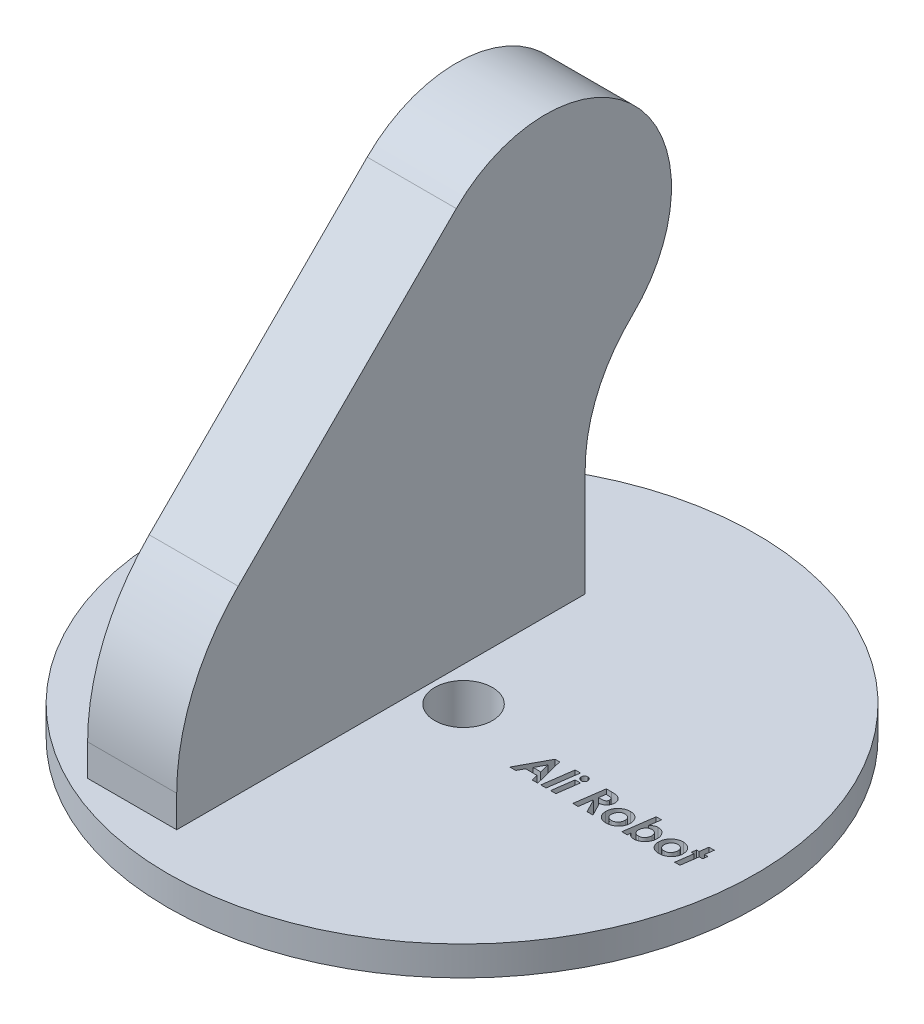
from build123d import *

# Parameters (mm, degrees)
SKETCH2_R           = 35
BOSS_EXTRUDE1_DEPTH = 3.5
BOSS_EXTRUDE2_DEPTH = 10.6
SKETCH33_R          = 30
BOSS_EXTRUDE3_DEPTH = 2.2
SKETCH35_R          = 3.43
CUT_EXTRUDE22_DEPTH = 120.985333145
CUT_EXTRUDE24_DEPTH = 3


with BuildPart() as part:
    # Sketch2 → Boss-Extrude1 (new body)
    with BuildSketch(Plane(origin=(0, 0, 0), x_dir=(1, 0, 0), z_dir=(0, 1, 0))):
        Circle(SKETCH2_R)
    extrude(amount=BOSS_EXTRUDE1_DEPTH)

    # Sketch33 → Boss-Extrude3 (add)
    with BuildSketch(Plane.XZ):
        Circle(SKETCH33_R)
    extrude(amount=BOSS_EXTRUDE3_DEPTH)

    # Sketch35 → Cut-Extrude22 (cut, through all)
    with BuildSketch(Plane(origin=(64.920383929, 3.5, -6.612415768), x_dir=(1, 0, 0), z_dir=(0, 1, 0))):
        with Locations((-64.816151671, -6.541004949)):
            Circle(SKETCH35_R)
    extrude(amount=-CUT_EXTRUDE22_DEPTH, mode=Mode.SUBTRACT)

    # Sketch38 → Cut-Extrude24 (cut)
    # profile 1 of 9: a face of its own
    with BuildSketch(Plane(origin=(0, 3.5, 0), x_dir=(1, 0, 0), z_dir=(0, 1, 0))):
        Polygon((11.234213374, -0.170104505), (11.785295104, -0.170104505), (12.673616419, -3.670104505), (12.027182124, -3.670104505), (11.833672508, -2.907283992), (10.469289496, -2.907283992), (10.059834367, -3.670104505), (9.353103598, -3.670104505), align=None)
        Polygon((11.684333566, -2.323950659), (11.395471387, -1.184627742), (10.78339206, -2.323950659), align=None, mode=Mode.SUBTRACT)
    # profile 2 of 9: a face of its own
    with BuildSketch(Plane(origin=(0, 3.5, 0), x_dir=(1, 0, 0), z_dir=(0, 1, 0))):
        Polygon((13.535996226, -0.080360915), (14.169810329, -0.080360915), (13.66640488, -3.670104505), (13.032590778, -3.670104505), align=None)
    # profile 3 of 9: a face of its own
    with BuildSketch(Plane(origin=(0, 3.5, 0), x_dir=(1, 0, 0), z_dir=(0, 1, 0))):
        with BuildLine():
            add(Edge.make_bspline(
                [(15.006949752, -0.03548912), (15.033724236, -0.037050399), (15.086317182, -0.040117209), (15.162584245, -0.062149233), (15.231434376, -0.101556531), (15.293403814, -0.152881213), (15.344728495, -0.21485065), (15.384135793, -0.283700781), (15.406167817, -0.359967844), (15.409234627, -0.41256079), (15.410795906, -0.439335274)],
                knots=[0, 0, 0, 0, 1.014134371, 1.992057583, 2.975098753, 4, 5.024901247, 6.007942417, 6.985865629, 8, 8, 8, 8], degree=3))
            add(Edge.make_bspline(
                [(15.410795906, -0.439335274), (15.409245272, -0.466115808), (15.406199373, -0.518720637), (15.383956784, -0.595099209), (15.344970591, -0.664433822), (15.29334378, -0.726417249), (15.231646153, -0.777958507), (15.162369408, -0.816365475), (15.086344614, -0.83860223), (15.03373349, -0.841636642), (15.006949752, -0.843181428)],
                knots=[0, 0, 0, 0, 1.013694729, 1.991193998, 2.981551723, 4.006008661, 5.030465598, 6.008806002, 6.986305271, 8, 8, 8, 8], degree=3))
            add(Edge.make_bspline(
                [(15.006949752, -0.843181428), (14.980160104, -0.841647208), (14.927537372, -0.83863355), (14.85139842, -0.816186723), (14.781641719, -0.77820039), (14.719927005, -0.726358021), (14.668084636, -0.664643307), (14.630098303, -0.594886606), (14.607651476, -0.518747654), (14.604637818, -0.466124922), (14.603103598, -0.439335274)],
                knots=[0, 0, 0, 0, 1.01324697, 1.990314468, 2.975995575, 4, 5.024004425, 6.009685532, 6.98675303, 8, 8, 8, 8], degree=3))
            add(Edge.make_bspline(
                [(14.603103598, -0.439335274), (14.604648384, -0.412551536), (14.607682796, -0.359940413), (14.629919552, -0.283915618), (14.668326519, -0.214638873), (14.719867777, -0.152941246), (14.781851204, -0.101314435), (14.851185818, -0.062328242), (14.927564389, -0.040085653), (14.980169218, -0.037039754), (15.006949752, -0.03548912)],
                knots=[0, 0, 0, 0, 1.013694729, 1.991193998, 2.969534402, 3.993991339, 5.018448277, 6.008806002, 6.986305271, 8, 8, 8, 8], degree=3))
        make_face()
    # profile 4 of 9: a face of its own
    with BuildSketch(Plane(origin=(0, 3.5, 0), x_dir=(1, 0, 0), z_dir=(0, 1, 0))):
        Polygon((14.562438534, -1.112412197), (15.196252637, -1.112412197), (14.833071547, -3.670104505), (14.199257444, -3.670104505), align=None)
    # profile 5 of 9: a face of its own
    with BuildSketch(Plane(origin=(0, 3.5, 0), x_dir=(1, 0, 0), z_dir=(0, 1, 0))):
        with BuildLine():
            Line((17.337478598, -0.170104505), (17.945351194, -0.170104505))
            add(Edge.make_bspline(
                [(17.945351194, -0.170104505), (17.990461912, -0.170288853), (18.0774408, -0.170644298), (18.20251927, -0.175698725), (18.317320027, -0.183324297), (18.421706567, -0.19338775), (18.515766042, -0.207350229), (18.599302851, -0.224114981), (18.672850562, -0.242784868), (18.716956864, -0.260134145), (18.737618822, -0.268261556)],
                knots=[0, 0, 0, 0, 1.348808202, 2.600664361, 3.742342956, 4.788858012, 5.735658768, 6.584006912, 7.336666444, 8, 8, 8, 8], degree=3))
            add(Edge.make_bspline(
                [(18.737618822, -0.268261556), (18.760881531, -0.278751926), (18.806356444, -0.29925894), (18.871519344, -0.334019586), (18.932539327, -0.371466236), (18.988405098, -0.413010751), (19.040295597, -0.456903826), (19.087889056, -0.503562941), (19.130802248, -0.55370417), (19.169485538, -0.606428163), (19.203882551, -0.661666729), (19.233408844, -0.719692265), (19.258939718, -0.780013512), (19.278877214, -0.843286871), (19.29544767, -0.908752815), (19.30616484, -0.97682439), (19.313707078, -1.04727198), (19.314326819, -1.095096686), (19.31464206, -1.119423415)],
                knots=[0, 0, 0, 0, 1.116361014, 2.182309107, 3.229450697, 4.24598407, 5.225421932, 6.201651319, 7.158895679, 8.110002388, 9.060669178, 10.002827475, 10.956240434, 11.923213192, 12.902917952, 13.908279153, 14.936015885, 16, 16, 16, 16], degree=3))
            add(Edge.make_bspline(
                [(19.31464206, -1.119423415), (19.313900694, -1.14935913), (19.312437117, -1.208457078), (19.302873802, -1.295604951), (19.285037031, -1.379232383), (19.261016279, -1.459602808), (19.231256497, -1.537236615), (19.192877363, -1.610782918), (19.148515858, -1.681523171), (19.097282847, -1.748529924), (19.040017621, -1.812417855), (18.973896349, -1.869427088), (18.902576953, -1.923391655), (18.823129531, -1.97069347), (18.737739084, -2.014632643), (18.644457977, -2.051860582), (18.545036949, -2.086216223), (18.475324737, -2.103410743), (18.43964206, -2.112211877)],
                knots=[0, 0, 0, 0, 0.995453645, 1.965186658, 2.910129054, 3.83459069, 4.752398018, 5.669942118, 6.588407184, 7.525617038, 8.471772905, 9.435289717, 10.423772802, 11.441988612, 12.505459691, 13.613754905, 14.778583949, 16, 16, 16, 16], degree=3))
            Line((18.43964206, -2.112211877), (19.247334367, -3.670104505))
            Line((19.247334367, -3.670104505), (18.545511451, -3.670104505))
            Line((18.545511451, -3.670104505), (17.754646066, -2.144463479))
            Line((17.754646066, -2.144463479), (17.695050713, -2.144463479))
            Line((17.695050713, -2.144463479), (17.480507444, -3.670104505))
            Line((17.480507444, -3.670104505), (16.846693342, -3.670104505))
            Line((16.846693342, -3.670104505), (17.337478598, -0.170104505))
        make_face()
        with BuildLine():
            add(Edge.make_bspline(
                [(17.777081963, -1.561130146), (17.822194038, -1.560711256), (17.908482086, -1.559910025), (18.031718476, -1.554336883), (18.14284927, -1.545533343), (18.241553965, -1.532952509), (18.328092207, -1.518073936), (18.40209638, -1.499499099), (18.463905682, -1.477413957), (18.514495006, -1.451223183), (18.555475842, -1.42047266), (18.590946517, -1.387657032), (18.620482235, -1.350923569), (18.644851849, -1.31088895), (18.66364733, -1.267470195), (18.677201777, -1.220373146), (18.684696139, -1.16991183), (18.685848236, -1.135105351), (18.686436931, -1.11732005)],
                knots=[0, 0, 0, 0, 1.892208387, 3.619318591, 5.173427176, 6.566868293, 7.791773198, 8.8545744, 9.763297566, 10.539470204, 11.233547833, 11.906251103, 12.5615143, 13.203742025, 13.866659999, 14.539934446, 15.25394049, 16, 16, 16, 16], degree=3))
            add(Edge.make_bspline(
                [(18.686436931, -1.11732005), (18.685674889, -1.097154087), (18.68419663, -1.058034883), (18.671410296, -1.001691948), (18.649546106, -0.950581254), (18.618818966, -0.905191441), (18.580473147, -0.865168951), (18.53369335, -0.832205814), (18.479014112, -0.806257483), (18.427792709, -0.789114207), (18.379308966, -0.779184383), (18.334112776, -0.772512871), (18.280601749, -0.7660751), (18.218614928, -0.761314571), (18.148226827, -0.75816557), (18.069473284, -0.755105638), (17.982513177, -0.754017509), (17.921746603, -0.753636911), (17.889962572, -0.753437838)],
                knots=[0, 0, 0, 0, 0.974340854, 1.890087692, 2.776057671, 3.647490651, 4.526730822, 5.442477659, 6.397820337, 7.445016909, 8.045730266, 8.789007992, 9.653967296, 10.651691253, 11.794598421, 13.061237498, 14.462876682, 16, 16, 16, 16], degree=3))
            Line((17.889962572, -0.753437838), (17.777081963, -1.561130146))
        make_face(mode=Mode.SUBTRACT)
    # profile 6 of 9: a face of its own
    with BuildSketch(Plane(origin=(0, 3.5, 0), x_dir=(1, 0, 0), z_dir=(0, 1, 0))):
        with BuildLine():
            add(Edge.make_bspline(
                [(21.10390488, -1.067540402), (21.132205676, -1.067801263), (21.188216739, -1.068317542), (21.271251688, -1.076791941), (21.352561402, -1.088283547), (21.431755309, -1.105087467), (21.508763418, -1.127042832), (21.583911738, -1.1537877), (21.657385991, -1.185052775), (21.728169586, -1.221737771), (21.79620025, -1.2622808), (21.860854534, -1.306994684), (21.921055687, -1.356524279), (21.978491813, -1.408937638), (22.030743266, -1.466611664), (22.079230459, -1.527904512), (22.124539495, -1.592781526), (22.16560308, -1.661642395), (22.201764854, -1.734065485), (22.234420935, -1.808192303), (22.261103392, -1.885165214), (22.28235286, -1.964249823), (22.30065848, -2.045266898), (22.311711934, -2.128584003), (22.320319088, -2.213929685), (22.32080558, -2.271576635), (22.321052316, -2.30081364)],
                knots=[0, 0, 0, 0, 1.048380346, 2.074885017, 3.090367486, 4.090964834, 5.072523792, 6.056029873, 7.045505985, 8.029469653, 9.008388104, 9.979110116, 10.939576094, 11.895736256, 12.858269977, 13.820062943, 14.790784955, 15.789017664, 16.788414625, 17.789274365, 18.789121639, 19.804049856, 20.823403653, 21.864603227, 22.916983403, 24, 24, 24, 24], degree=3))
            add(Edge.make_bspline(
                [(22.321052316, -2.30081364), (22.319619601, -2.349019816), (22.316797746, -2.443966047), (22.297012332, -2.583639323), (22.263197648, -2.71753656), (22.215858626, -2.846045115), (22.155304616, -2.969198555), (22.081284251, -3.087107245), (21.992933579, -3.198542586), (21.893318647, -3.303762939), (21.784010872, -3.400153265), (21.666804377, -3.484466244), (21.543203881, -3.555740679), (21.413517543, -3.614546208), (21.276800052, -3.659246415), (21.134065161, -3.691262002), (20.985073188, -3.711747396), (20.883586993, -3.71388631), (20.831869624, -3.7149763)],
                knots=[0, 0, 0, 0, 1.011104245, 1.991457176, 2.952197104, 3.902991464, 4.858928698, 5.826026836, 6.817568841, 7.837123857, 8.861887107, 9.870051414, 10.860623363, 11.850212162, 12.851715058, 13.872153699, 14.915649431, 16, 16, 16, 16], degree=3))
            add(Edge.make_bspline(
                [(20.831869624, -3.7149763), (20.787180608, -3.714153797), (20.699859256, -3.712546645), (20.572535065, -3.696510448), (20.451951023, -3.671832677), (20.338440225, -3.635615998), (20.231550643, -3.590365048), (20.131718852, -3.534302422), (20.038690652, -3.468474255), (19.954355691, -3.391708196), (19.877584733, -3.307755196), (19.811040754, -3.216412915), (19.75412752, -3.118885549), (19.708910665, -3.014632036), (19.672882858, -2.904560186), (19.647014793, -2.788376728), (19.631256388, -2.665832705), (19.629593856, -2.582011467), (19.628744624, -2.53919505)],
                knots=[0, 0, 0, 0, 1.130534475, 2.209039425, 3.242686211, 4.241648197, 5.219495055, 6.175504508, 7.134035888, 8.097337106, 9.056251676, 10.008649417, 10.952170628, 11.908308165, 12.879116703, 13.879338768, 14.916752852, 16, 16, 16, 16], degree=3))
            add(Edge.make_bspline(
                [(19.628744624, -2.53919505), (19.630129394, -2.487484152), (19.63285354, -2.385757449), (19.653222978, -2.236445943), (19.688511473, -2.094173346), (19.737255381, -1.958685096), (19.798811542, -1.829343138), (19.876295949, -1.707787872), (19.966196952, -1.592038304), (20.069660962, -1.485284387), (20.181690912, -1.387899142), (20.299281022, -1.301752877), (20.422559058, -1.230100692), (20.549460565, -1.169585046), (20.682121593, -1.124371206), (20.818625267, -1.091170449), (20.959799348, -1.070900032), (21.055460923, -1.068669809), (21.10390488, -1.067540402)],
                knots=[0, 0, 0, 0, 1.070407058, 2.105725986, 3.11260329, 4.099768105, 5.082273654, 6.071629737, 7.078227986, 8.111679688, 9.144009435, 10.148605521, 11.124500349, 12.092034995, 13.054511379, 14.020338642, 14.997480131, 16, 16, 16, 16], degree=3))
        make_face()
        with BuildLine():
            add(Edge.make_bspline(
                [(21.057630842, -1.650873736), (21.026269955, -1.651636447), (20.965150904, -1.653122889), (20.876302302, -1.665982872), (20.79304741, -1.686932574), (20.715073471, -1.716261753), (20.643419269, -1.755392612), (20.576507562, -1.801790198), (20.516281479, -1.857752454), (20.462012486, -1.920664044), (20.414176698, -1.988504559), (20.372137329, -2.058299005), (20.336555272, -2.129766087), (20.308269609, -2.202725024), (20.284359334, -2.276698707), (20.268472408, -2.352366514), (20.259260913, -2.429591807), (20.257725534, -2.481444774), (20.256949752, -2.507644569)],
                knots=[0, 0, 0, 0, 1.147646984, 2.236642535, 3.278363253, 4.285788599, 5.277283386, 6.259990092, 7.25913394, 8.278119336, 9.296601724, 10.294389209, 11.258634566, 12.215104854, 13.156804447, 14.101569642, 15.040778374, 16, 16, 16, 16], degree=3))
            add(Edge.make_bspline(
                [(20.256949752, -2.507644569), (20.257532631, -2.530566622), (20.258672044, -2.575374643), (20.26627562, -2.640906789), (20.279776611, -2.702779036), (20.297767954, -2.76144146), (20.321967792, -2.816579396), (20.351167991, -2.868405184), (20.386215923, -2.916407622), (20.424970871, -2.961466715), (20.469417067, -3.001175849), (20.516988562, -3.036297243), (20.568043814, -3.066353198), (20.623114972, -3.08986505), (20.681451247, -3.109062165), (20.743278336, -3.12217512), (20.808531786, -3.129982068), (20.853114676, -3.131078932), (20.876040297, -3.131642967)],
                knots=[0, 0, 0, 0, 1.110133544, 2.170088686, 3.189065258, 4.17351184, 5.136579884, 6.099647928, 7.048308506, 8.010844321, 8.972448026, 9.927769731, 10.871216919, 11.834284962, 12.822174017, 13.841150589, 14.889866456, 16, 16, 16, 16], degree=3))
            add(Edge.make_bspline(
                [(20.876040297, -3.131642967), (20.908327519, -3.13081147), (20.971260249, -3.129190756), (21.062683434, -3.117309576), (21.148088828, -3.097133982), (21.227451551, -3.068248614), (21.300688371, -3.030725324), (21.368699859, -2.985891305), (21.429944961, -2.931876311), (21.48509304, -2.870934664), (21.533550481, -2.804751067), (21.575853609, -2.735370924), (21.612525236, -2.664120492), (21.642112388, -2.59018004), (21.664496143, -2.514049921), (21.680676275, -2.435740061), (21.690718735, -2.355059531), (21.692133156, -2.300374861), (21.692847188, -2.272768768)],
                knots=[0, 0, 0, 0, 1.164111062, 2.269030304, 3.317651816, 4.322802953, 5.30652745, 6.278887004, 7.252451034, 8.242831511, 9.237327035, 10.205734188, 11.170614506, 12.123681709, 13.072978069, 14.028315502, 15.004647829, 16, 16, 16, 16], degree=3))
            add(Edge.make_bspline(
                [(21.692847188, -2.272768768), (21.692320588, -2.250308024), (21.691285496, -2.206158886), (21.68279286, -2.141566002), (21.668601759, -2.080413151), (21.649936064, -2.022074887), (21.624294897, -1.967648418), (21.59433855, -1.915645637), (21.557203679, -1.868141891), (21.516160513, -1.823345671), (21.47081675, -1.782623151), (21.42121727, -1.747521842), (21.368893834, -1.71708776), (21.312660418, -1.693288489), (21.253512837, -1.674378403), (21.19119306, -1.66009748), (21.125354829, -1.652631844), (21.080550835, -1.651468737), (21.057630842, -1.650873736)],
                knots=[0, 0, 0, 0, 1.079193067, 2.121276228, 3.123935011, 4.093589047, 5.058482656, 6.010079462, 6.971567708, 7.949254825, 8.927715837, 9.893916005, 10.864935156, 11.830939453, 12.821955205, 13.846519011, 14.898362312, 16, 16, 16, 16], degree=3))
        make_face(mode=Mode.SUBTRACT)
    # profile 7 of 9: a face of its own
    with BuildSketch(Plane(origin=(0, 3.5, 0), x_dir=(1, 0, 0), z_dir=(0, 1, 0))):
        with BuildLine():
            Line((23.313840778, -3.670104505), (22.680026675, -3.670104505))
            Line((22.680026675, -3.670104505), (23.183432124, -0.080360915))
            Line((23.183432124, -0.080360915), (23.816545104, -0.080360915))
            Line((23.816545104, -0.080360915), (23.62724222, -1.431422614))
            add(Edge.make_bspline(
                [(23.62724222, -1.431422614), (23.660177044, -1.399109951), (23.722878643, -1.337592827), (23.819913625, -1.257983779), (23.913193306, -1.193936975), (24.005187179, -1.145305221), (24.098742939, -1.110612562), (24.195640627, -1.085114674), (24.298223302, -1.070244068), (24.368279889, -1.068454853), (24.404085169, -1.067540402)],
                knots=[0, 0, 0, 0, 1.251006972, 2.381677804, 3.399685655, 4.315539795, 5.196231247, 6.100316428, 7.029089122, 8, 8, 8, 8], degree=3))
            add(Edge.make_bspline(
                [(24.404085169, -1.067540402), (24.445287674, -1.068485671), (24.525749337, -1.070331624), (24.643204002, -1.088646533), (24.754232376, -1.117047879), (24.859019208, -1.15696827), (24.956475295, -1.209814729), (25.048312142, -1.272826908), (25.132725115, -1.348770844), (25.209846362, -1.434799464), (25.27933836, -1.527884039), (25.33968521, -1.62604411), (25.392255494, -1.727123958), (25.434281606, -1.832633065), (25.466552847, -1.941835417), (25.48961194, -2.054416651), (25.504092748, -2.170730285), (25.505988174, -2.249589314), (25.506949752, -2.289595691)],
                knots=[0, 0, 0, 0, 1.074461769, 2.098245705, 3.093738161, 4.060957578, 5.015928931, 5.980202173, 6.960712075, 7.971130566, 8.990819314, 9.98765587, 10.975026468, 11.960285364, 12.946317818, 13.942631884, 14.956266082, 16, 16, 16, 16], degree=3))
            add(Edge.make_bspline(
                [(25.506949752, -2.289595691), (25.506485439, -2.320470332), (25.505561779, -2.381889453), (25.495813586, -2.473415201), (25.4813639, -2.564117418), (25.460305544, -2.653867108), (25.432779537, -2.742293146), (25.399567925, -2.82953584), (25.361221982, -2.915948082), (25.316298398, -3.000256141), (25.266843562, -3.082073165), (25.212840452, -3.159694669), (25.155387397, -3.233294504), (25.092786476, -3.301015233), (25.02655498, -3.364505202), (24.956494381, -3.423572461), (24.881754013, -3.47756321), (24.803840208, -3.527078419), (24.723179042, -3.57113124), (24.641359309, -3.609869553), (24.558288967, -3.6420021), (24.474837248, -3.668999362), (24.390386293, -3.689199505), (24.305160276, -3.703946802), (24.218975194, -3.713542499), (24.161054574, -3.714497878), (24.132049912, -3.7149763)],
                knots=[0, 0, 0, 0, 1.013451801, 2.016066107, 3.019062145, 4.027971124, 5.040172772, 6.057828882, 7.091818133, 8.14227902, 9.192543668, 10.229263228, 11.245616414, 12.255867067, 13.254567598, 14.256800029, 15.26222985, 16.27988596, 17.286164752, 18.278298122, 19.250221527, 20.208875209, 21.15628221, 22.098734397, 23.047911355, 24, 24, 24, 24], degree=3))
            add(Edge.make_bspline(
                [(24.132049912, -3.7149763), (24.093171265, -3.713587548), (24.016277583, -3.710840893), (23.903498917, -3.690228625), (23.79579298, -3.655262854), (23.693309546, -3.607746487), (23.597518856, -3.546982021), (23.511655579, -3.471759408), (23.432370037, -3.386507872), (23.389570427, -3.320715947), (23.367827156, -3.287292005)],
                knots=[0, 0, 0, 0, 1.017645626, 2.01268628, 2.989956243, 3.975524875, 4.963465289, 5.948444836, 6.95775873, 8, 8, 8, 8], degree=3))
            Line((23.367827156, -3.287292005), (23.313840778, -3.670104505))
        make_face()
        with BuildLine():
            add(Edge.make_bspline(
                [(24.265263053, -1.650873736), (24.228968933, -1.652102616), (24.158238745, -1.654497465), (24.055407816, -1.672667991), (23.960088703, -1.704745444), (23.871134011, -1.748066448), (23.790345373, -1.806273578), (23.715653776, -1.877031365), (23.649507263, -1.963123617), (23.590054465, -2.059494251), (23.541668223, -2.163617884), (23.505225164, -2.270612742), (23.483457468, -2.379392755), (23.480684848, -2.452396344), (23.479305521, -2.488714281)],
                knots=[0, 0, 0, 0, 1.020631644, 1.989012793, 2.92445932, 3.841689372, 4.76099003, 5.714169008, 6.725443104, 7.805523698, 8.893656079, 9.947594549, 10.978966212, 12, 12, 12, 12], degree=3))
            add(Edge.make_bspline(
                [(23.479305521, -2.488714281), (23.479880618, -2.512339552), (23.481005486, -2.558549754), (23.488729431, -2.626136473), (23.501772501, -2.690088284), (23.52120186, -2.750219249), (23.544746002, -2.807313215), (23.574290204, -2.860601683), (23.609165582, -2.910337835), (23.648779905, -2.956220431), (23.692954796, -2.997921983), (23.741494491, -3.033429202), (23.793008881, -3.064116944), (23.848068499, -3.088256666), (23.905962492, -3.108722547), (23.967819684, -3.121165115), (24.032692366, -3.130219437), (24.077094213, -3.131161341), (24.09979831, -3.131642967)],
                knots=[0, 0, 0, 0, 1.126186038, 2.20278045, 3.238531955, 4.232199798, 5.210951865, 6.178414309, 7.130420157, 8.102043749, 9.063714879, 10.019689469, 10.96364203, 11.916169311, 12.881576601, 13.884632073, 14.918344105, 16, 16, 16, 16], degree=3))
            add(Edge.make_bspline(
                [(24.09979831, -3.131642967), (24.126486516, -3.131068206), (24.178941073, -3.129938537), (24.255911966, -3.118063791), (24.330043349, -3.100131687), (24.400958776, -3.074004662), (24.468729446, -3.040689075), (24.533661769, -3.000757277), (24.594945241, -2.952450746), (24.652597178, -2.897439839), (24.705687784, -2.836877111), (24.752381551, -2.771554995), (24.791000144, -2.701195744), (24.82348501, -2.627193526), (24.847714734, -2.548490868), (24.86639777, -2.466085248), (24.87672908, -2.379136017), (24.878065423, -2.319769131), (24.878744624, -2.289595691)],
                knots=[0, 0, 0, 0, 0.998366777, 1.962248238, 2.9086585, 3.849756023, 4.784937843, 5.731833278, 6.697935849, 7.700472628, 8.711184204, 9.708937404, 10.699800307, 11.710776929, 12.729071636, 13.777697986, 14.87050675, 16, 16, 16, 16], degree=3))
            add(Edge.make_bspline(
                [(24.878744624, -2.289595691), (24.878166027, -2.266205274), (24.877034532, -2.220463372), (24.869363374, -2.153555367), (24.85608738, -2.090150181), (24.837192797, -2.030183276), (24.812400245, -1.97397123), (24.782987899, -1.920860313), (24.74762681, -1.87173701), (24.707682685, -1.826223703), (24.663776511, -1.784799273), (24.615888899, -1.749077356), (24.565052455, -1.718418003), (24.510699896, -1.694240055), (24.453915097, -1.674028431), (24.393539086, -1.661235902), (24.330498066, -1.652349873), (24.287264398, -1.651371582), (24.265263053, -1.650873736)],
                knots=[0, 0, 0, 0, 1.12759846, 2.205112442, 3.24149039, 4.246337781, 5.230184043, 6.198685213, 7.167907017, 8.141962875, 9.114453566, 10.072146408, 11.017028515, 11.970004121, 12.93561737, 13.916944341, 14.939945928, 16, 16, 16, 16], degree=3))
        make_face(mode=Mode.SUBTRACT)
    # profile 8 of 9: a face of its own
    with BuildSketch(Plane(origin=(0, 3.5, 0), x_dir=(1, 0, 0), z_dir=(0, 1, 0))):
        with BuildLine():
            add(Edge.make_bspline(
                [(27.385956162, -1.067540402), (27.414256958, -1.067801263), (27.470268021, -1.068317542), (27.55330297, -1.076791941), (27.634612684, -1.088283547), (27.713806591, -1.105087467), (27.7908147, -1.127042832), (27.86596302, -1.1537877), (27.939437273, -1.185052775), (28.010220868, -1.221737771), (28.078251532, -1.2622808), (28.142905816, -1.306994684), (28.203106969, -1.356524279), (28.260543095, -1.408937638), (28.312794548, -1.466611664), (28.361281741, -1.527904512), (28.406590777, -1.592781526), (28.447654362, -1.661642395), (28.483816136, -1.734065485), (28.516472217, -1.808192303), (28.543154674, -1.885165214), (28.564404142, -1.964249823), (28.582709762, -2.045266898), (28.593763216, -2.128584003), (28.60237037, -2.213929685), (28.602856862, -2.271576635), (28.603103598, -2.30081364)],
                knots=[0, 0, 0, 0, 1.048380346, 2.074885017, 3.090367486, 4.090964834, 5.072523792, 6.056029873, 7.045505985, 8.029469653, 9.008388104, 9.979110116, 10.939576094, 11.895736256, 12.858269977, 13.820062943, 14.790784955, 15.789017664, 16.788414625, 17.789274365, 18.789121639, 19.804049856, 20.823403653, 21.864603227, 22.916983403, 24, 24, 24, 24], degree=3))
            add(Edge.make_bspline(
                [(28.603103598, -2.30081364), (28.601670883, -2.349019816), (28.598849028, -2.443966047), (28.579063614, -2.583639323), (28.54524893, -2.71753656), (28.497909908, -2.846045115), (28.437355898, -2.969198555), (28.363335533, -3.087107245), (28.274984861, -3.198542586), (28.175369929, -3.303762939), (28.066062154, -3.400153265), (27.948855659, -3.484466244), (27.825255163, -3.555740679), (27.695568825, -3.614546208), (27.558851334, -3.659246415), (27.416116443, -3.691262002), (27.26712447, -3.711747396), (27.165638275, -3.71388631), (27.113920906, -3.7149763)],
                knots=[0, 0, 0, 0, 1.011104245, 1.991457176, 2.952197104, 3.902991464, 4.858928698, 5.826026836, 6.817568841, 7.837123857, 8.861887107, 9.870051414, 10.860623363, 11.850212162, 12.851715058, 13.872153699, 14.915649431, 16, 16, 16, 16], degree=3))
            add(Edge.make_bspline(
                [(27.113920906, -3.7149763), (27.06923189, -3.714153797), (26.981910538, -3.712546645), (26.854586347, -3.696510448), (26.734002305, -3.671832677), (26.620491507, -3.635615998), (26.513601925, -3.590365048), (26.413770134, -3.534302422), (26.320741934, -3.468474255), (26.236406974, -3.391708196), (26.159636015, -3.307755196), (26.093092036, -3.216412915), (26.036178802, -3.118885549), (25.990961947, -3.014632036), (25.95493414, -2.904560186), (25.929066075, -2.788376728), (25.913307671, -2.665832705), (25.911645138, -2.582011467), (25.910795906, -2.53919505)],
                knots=[0, 0, 0, 0, 1.130534475, 2.209039425, 3.242686211, 4.241648197, 5.219495055, 6.175504508, 7.134035888, 8.097337106, 9.056251676, 10.008649417, 10.952170628, 11.908308165, 12.879116703, 13.879338768, 14.916752852, 16, 16, 16, 16], degree=3))
            add(Edge.make_bspline(
                [(25.910795906, -2.53919505), (25.912180676, -2.487484152), (25.914904822, -2.385757449), (25.93527426, -2.236445943), (25.970562755, -2.094173346), (26.019306663, -1.958685096), (26.080862824, -1.829343138), (26.158347231, -1.707787872), (26.248248234, -1.592038304), (26.351712244, -1.485284387), (26.463742194, -1.387899142), (26.581332304, -1.301752877), (26.70461034, -1.230100692), (26.831511847, -1.169585046), (26.964172875, -1.124371206), (27.100676549, -1.091170449), (27.24185063, -1.070900032), (27.337512205, -1.068669809), (27.385956162, -1.067540402)],
                knots=[0, 0, 0, 0, 1.070407058, 2.105725986, 3.11260329, 4.099768105, 5.082273654, 6.071629737, 7.078227986, 8.111679688, 9.144009435, 10.148605521, 11.124500349, 12.092034995, 13.054511379, 14.020338642, 14.997480131, 16, 16, 16, 16], degree=3))
        make_face()
        with BuildLine():
            add(Edge.make_bspline(
                [(27.339682124, -1.650873736), (27.308321237, -1.651636447), (27.247202186, -1.653122889), (27.158353584, -1.665982872), (27.075098692, -1.686932574), (26.997124753, -1.716261753), (26.925470551, -1.755392612), (26.858558844, -1.801790198), (26.798332761, -1.857752454), (26.744063768, -1.920664044), (26.69622798, -1.988504559), (26.654188611, -2.058299005), (26.618606554, -2.129766087), (26.590320891, -2.202725024), (26.566410616, -2.276698707), (26.55052369, -2.352366514), (26.541312195, -2.429591807), (26.539776816, -2.481444774), (26.539001034, -2.507644569)],
                knots=[0, 0, 0, 0, 1.147646984, 2.236642535, 3.278363253, 4.285788599, 5.277283386, 6.259990092, 7.25913394, 8.278119336, 9.296601724, 10.294389209, 11.258634566, 12.215104854, 13.156804447, 14.101569642, 15.040778374, 16, 16, 16, 16], degree=3))
            add(Edge.make_bspline(
                [(26.539001034, -2.507644569), (26.539583913, -2.530566622), (26.540723326, -2.575374643), (26.548326902, -2.640906789), (26.561827893, -2.702779036), (26.579819236, -2.76144146), (26.604019074, -2.816579396), (26.633219273, -2.868405184), (26.668267205, -2.916407622), (26.707022153, -2.961466715), (26.751468349, -3.001175849), (26.799039844, -3.036297243), (26.850095096, -3.066353198), (26.905166254, -3.08986505), (26.963502529, -3.109062165), (27.025329618, -3.12217512), (27.090583068, -3.129982068), (27.135165958, -3.131078932), (27.158091579, -3.131642967)],
                knots=[0, 0, 0, 0, 1.110133544, 2.170088686, 3.189065258, 4.17351184, 5.136579884, 6.099647928, 7.048308506, 8.010844321, 8.972448026, 9.927769731, 10.871216919, 11.834284962, 12.822174017, 13.841150589, 14.889866456, 16, 16, 16, 16], degree=3))
            add(Edge.make_bspline(
                [(27.158091579, -3.131642967), (27.190378801, -3.13081147), (27.253311531, -3.129190756), (27.344734716, -3.117309576), (27.43014011, -3.097133982), (27.509502833, -3.068248614), (27.582739653, -3.030725324), (27.650751141, -2.985891305), (27.711996243, -2.931876311), (27.767144322, -2.870934664), (27.815601763, -2.804751067), (27.857904891, -2.735370924), (27.894576518, -2.664120492), (27.92416367, -2.59018004), (27.946547425, -2.514049921), (27.962727557, -2.435740061), (27.972770017, -2.355059531), (27.974184438, -2.300374861), (27.97489847, -2.272768768)],
                knots=[0, 0, 0, 0, 1.164111062, 2.269030304, 3.317651816, 4.322802953, 5.30652745, 6.278887004, 7.252451034, 8.242831511, 9.237327035, 10.205734188, 11.170614506, 12.123681709, 13.072978069, 14.028315502, 15.004647829, 16, 16, 16, 16], degree=3))
            add(Edge.make_bspline(
                [(27.97489847, -2.272768768), (27.97437187, -2.250308024), (27.973336778, -2.206158886), (27.964844142, -2.141566002), (27.950653041, -2.080413151), (27.931987347, -2.022074887), (27.906346179, -1.967648418), (27.876389832, -1.915645637), (27.839254961, -1.868141891), (27.798211795, -1.823345671), (27.752868032, -1.782623151), (27.703268552, -1.747521842), (27.650945116, -1.71708776), (27.5947117, -1.693288489), (27.535564119, -1.674378403), (27.473244342, -1.66009748), (27.407406111, -1.652631844), (27.362602117, -1.651468737), (27.339682124, -1.650873736)],
                knots=[0, 0, 0, 0, 1.079193067, 2.121276228, 3.123935011, 4.093589047, 5.058482656, 6.010079462, 6.971567708, 7.949254825, 8.927715837, 9.893916005, 10.864935156, 11.830939453, 12.821955205, 13.846519011, 14.898362312, 16, 16, 16, 16], degree=3))
        make_face(mode=Mode.SUBTRACT)
    # profile 9 of 9: a face of its own
    with BuildSketch(Plane(origin=(0, 3.5, 0), x_dir=(1, 0, 0), z_dir=(0, 1, 0))):
        Polygon((29.459874431, -0.080360915), (30.092987412, -0.080360915), (29.949958566, -1.112412197), (30.350299111, -1.112412197), (30.274577957, -1.650873736), (29.874938534, -1.650873736), (29.595190938, -3.670104505), (28.962077957, -3.670104505), (29.241825553, -1.650873736), (28.93192972, -1.650873736), (29.004846387, -1.112412197), (29.316845585, -1.112412197), align=None)
    extrude(amount=-CUT_EXTRUDE24_DEPTH, mode=Mode.SUBTRACT)


with BuildPart() as body_2:
    # Sketch7 → Boss-Extrude2 (new body)
    with BuildSketch(Plane(origin=(-4, 0, 0), x_dir=(0, 0, -1), z_dir=(1, 0, 0))):
        with BuildLine():
            Line((18.652115716, 3.5), (18.652115716, 16.356133126))
            ThreePointArc((18.652115716, 16.356133126), (20.111216245, 23.455333411), (24.251965127, 29.403595153))
            ThreePointArc((24.251965127, 29.403595153), (24.659117989, 50.747356958), (3.311904584, 50.883081894))
            Line((3.311904584, 50.883081894), (-22.631121669, 24.94005564))
            ThreePointArc((-22.631121669, 24.94005564), (-28.050440452, 16.82947192), (-29.95345214, 7.262386111))
            Line((-29.95345214, 7.262386111), (-29.95345214, 3.5))
            Line((-29.95345214, 3.5), (18.652115716, 3.5))
        make_face()
    extrude(amount=-BOSS_EXTRUDE2_DEPTH)


solid = Compound([part.part, body_2.part])
